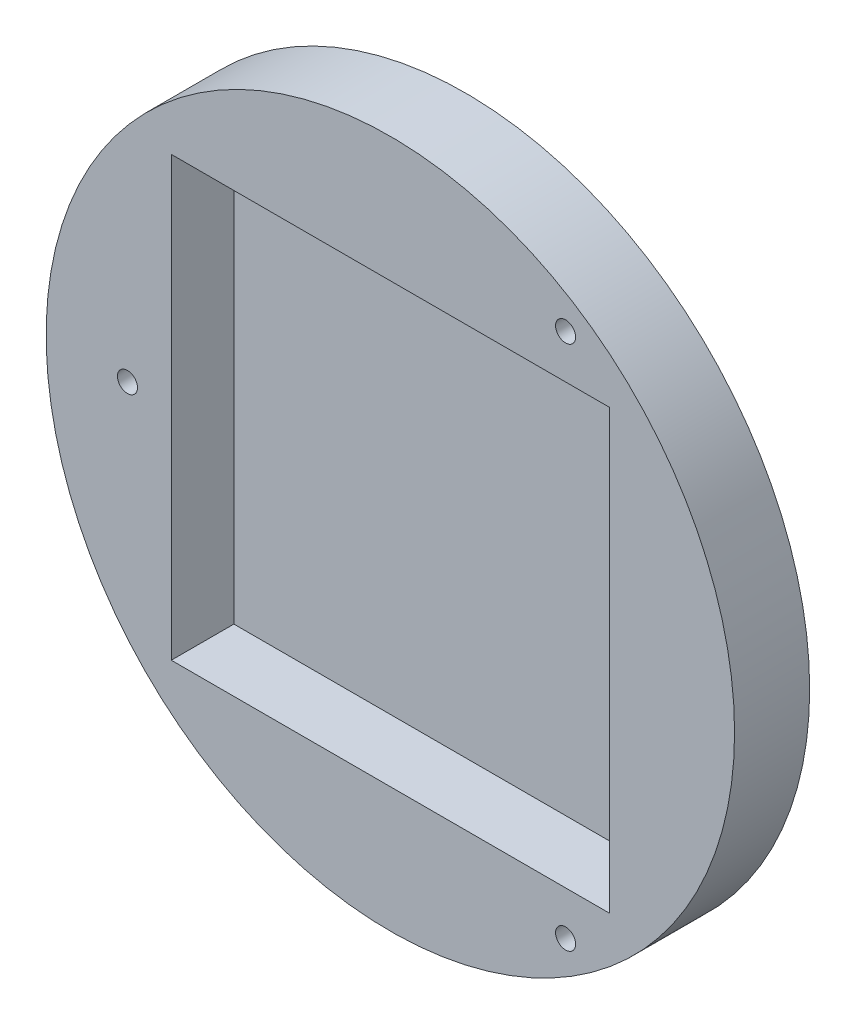
from build123d import *

# Parameters (mm, degrees)
SKETCH1_R             = 27.5
SKETCH1_W             = 35
SKETCH1_H             = 35
BOSS_EXTRUDE1_DEPTH   = 6
SKETCH1_3_W           = 35
SKETCH1_3_H           = 35
BOSS_EXTRUDE2_DEPTH   = 1
M2X0_4_TAPPED_HOLE1_D = 1.6


with BuildPart() as part:
    # Sketch1 → Boss-Extrude1 (new body)
    with BuildSketch(Plane.XY):
        Circle(SKETCH1_R)
        Rectangle(SKETCH1_W, SKETCH1_H, mode=Mode.SUBTRACT)
    extrude(amount=BOSS_EXTRUDE1_DEPTH)

    # Sketch1<3> → Boss-Extrude2 (add)
    with BuildSketch(Plane.XY):
        Rectangle(SKETCH1_3_W, SKETCH1_3_H)
    extrude(amount=BOSS_EXTRUDE2_DEPTH)

    # Sketch2 → Revolve1 (revolve)
    with BuildSketch(Plane(origin=(0, 0, 0), x_dir=(1, 0, 0), z_dir=(0, 1, 0))):
        with BuildLine():
            Line((0, 6.5), (0, 0))
            Line((0, 0), (-6.5, 0))
            ThreePointArc((-6.5, 0), (-4.596194078, 4.596194078), (0, 6.5))
        make_face()
    revolve(axis=Axis((0, 0, -15), (0, 0, 1)))

    # M2x0.4 Tapped Hole1 (through all)
    with Locations(Plane.XY.offset(6)):
        with Locations((-21, 0), (14, -21), (14, 21)):
            Hole(M2X0_4_TAPPED_HOLE1_D / 2)


solid = part.part
